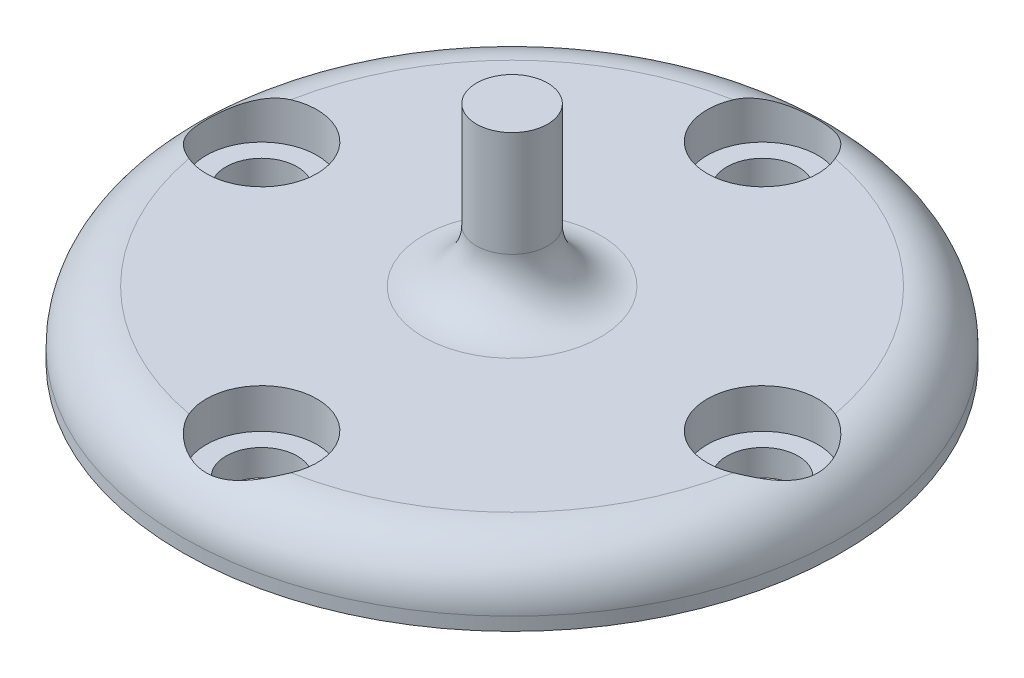
from build123d import *

# Parameters (mm, degrees)
SKETCH1_R           = 12.5
BOSS_EXTRUDE1_DEPTH = 2.5
SKETCH2_R           = 1.35
CUT_EXTRUDE1_DEPTH  = 18.853571071
SKETCH4_R           = 2.1
CUT_EXTRUDE2_DEPTH  = 1.5
CIRPATTERN1_COUNT   = 4
SKETCH3_R           = 1.35
BOSS_EXTRUDE2_DEPTH = 6
FILLET2_R           = 2
FILLET3_R           = 2


with BuildPart() as part:
    # Sketch1 → Boss-Extrude1 (new body)
    with BuildSketch(Plane(origin=(0, 0, 0), x_dir=(1, 0, 0), z_dir=(0, 1, 0))):
        with Locations(Location((0, 0, 0), (0, 0, 270))):
            Circle(SKETCH1_R)
    extrude(amount=BOSS_EXTRUDE1_DEPTH)

    # Sketch2 → Cut-Extrude1 (cut, through all)
    with BuildSketch(Plane(origin=(0, 2.5, 0), x_dir=(1, 0, 0), z_dir=(0, 1, 0))):
        with Locations(Location((0, 9.5, 0), (0, 0, 270))):
            Circle(SKETCH2_R)
    cut_extrude1 = extrude(amount=-CUT_EXTRUDE1_DEPTH, mode=Mode.SUBTRACT)

    # Sketch4 → Cut-Extrude2 (cut)
    with BuildSketch(Plane(origin=(0, 2.5, 0), x_dir=(1, 0, 0), z_dir=(0, 1, 0))):
        with Locations(Location((0, 9.5, 0), (0, 0, 270))):
            Circle(SKETCH4_R)
    cut_extrude2 = extrude(amount=-CUT_EXTRUDE2_DEPTH, mode=Mode.SUBTRACT)

    # CirPattern1: Cut-Extrude1, Cut-Extrude2 ×4 about axis
    cirpattern1_axis = Axis((0, 0, 0), (0, 1, 0))
    add([cut_extrude1.rotate(cirpattern1_axis, i * 360 / CIRPATTERN1_COUNT) for i in range(1, CIRPATTERN1_COUNT)], mode=Mode.SUBTRACT)
    add([cut_extrude2.rotate(cirpattern1_axis, i * 360 / CIRPATTERN1_COUNT) for i in range(1, CIRPATTERN1_COUNT)], mode=Mode.SUBTRACT)

    # Sketch3 → Boss-Extrude2 (add)
    with BuildSketch(Plane(origin=(0, 2.5, 0), x_dir=(1, 0, 0), z_dir=(0, 1, 0))):
        with Locations(Location((0, 0, 0), (0, 0, 270))):
            Circle(SKETCH3_R)
    extrude(amount=BOSS_EXTRUDE2_DEPTH)

    # Fillet2
    fillet2_edges = [part.edges().sort_by_distance(p)[0] for p in [
        (0, 2.5, -1.35),
    ]]
    fillet(fillet2_edges, radius=FILLET2_R)

    # Fillet3
    # the kernel refuses this fillet: 2 mm, written as the material it takes off along each edge
    with BuildSketch(Plane(origin=(0, 2.5, 0), x_dir=(0, 0, 1), z_dir=(-1, 0, 0))) as fillet3_piece_1:
        with BuildLine():
            CenterArc((12.5 - FILLET3_R, -FILLET3_R), FILLET3_R, 0, 90)
            Line((12.5, -FILLET3_R), (12.5, 0))
            Line((12.5, 0), (12.5 - FILLET3_R, 0))
        make_face()
    revolve(axis=Axis((0, 2.5, 0), (0, 1, 0)), mode=Mode.SUBTRACT)


solid = part.part
